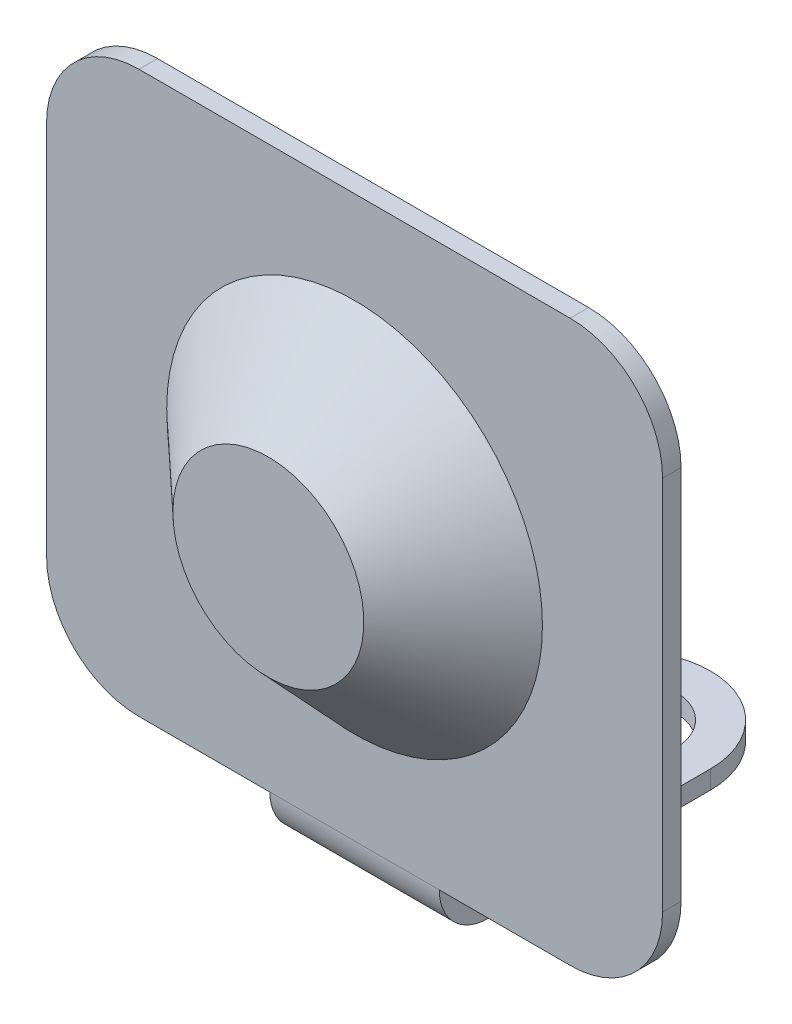
from build123d import *

# Parameters (mm, degrees)
SKETCH1_W                  = 10
SKETCH1_H                  = 9.1
BASE_FLANGE1_DEPTH         = 0.3
TAB1_DEPTH                 = 0.3
SKETCHED_START             = -12
SKETCHED_BEND1_OUTLINE_W   = 2.75
SKETCHED_BEND1_OUTLINE_H   = 0.3
SKETCHED_BEND1_DEPTH       = 6.725504
SKETCHED_START_2           = -5.274496
SKETCHED_BEND1_2_OUTLINE_W = 2.75
SKETCHED_BEND1_2_OUTLINE_H = 0.3
SKETCHED_BEND1_2_DEPTH     = 0.074434719
SKETCHED_START_3           = -5.35
SKETCHED_BEND1_3_DEPTH     = 0.8
SKETCHED_START_4           = -1.375
SKETCHED_BEND1_4_DEPTH     = 2.75
FILLET1_R                  = 1.5
SKETCH13_R                 = 0.8
CUT_EXTRUDE2_DEPTH         = 13.370499101


with BuildPart() as part:
    # Base-Flange1: sheet metal written as solids
    # Sketch1 → Base-Flange1 (new body)
    with BuildSketch(Plane.XY):
        Rectangle(SKETCH1_W, SKETCH1_H)
    extrude(amount=BASE_FLANGE1_DEPTH)

    # Tab1: sheet metal written as solids
    # Sketch7 → Tab1 (add)
    with BuildSketch(Plane.XY):
        with BuildLine():
            Line((1.375, 0), (1.375, -9.175))
            ThreePointArc((1.375, -9.175), (0, -10.55), (-1.375, -9.175))
            Line((-1.375, -9.175), (-1.375, 0))
            ThreePointArc((-1.375, 0), (0, 1.375), (1.375, 0))
        make_face()
    extrude(amount=TAB1_DEPTH)

    # Sketched Bend1: read off the stored shape, not the designer's step
    # Sketched Bend1 outline → Sketched Bend1 (cut)
    with BuildSketch(Plane(origin=(0, 0, 0), x_dir=(1, 0, 0), z_dir=(0, 1, 0)).offset(SKETCHED_START)):
        with Locations((0, -0.15)):
            Rectangle(SKETCHED_BEND1_OUTLINE_W, SKETCHED_BEND1_OUTLINE_H)
    extrude(amount=SKETCHED_BEND1_DEPTH, mode=Mode.SUBTRACT)

    # Sketched Bend1 2 outline → Sketched Bend1 2 (cut)
    with BuildSketch(Plane(origin=(0, 0, 0), x_dir=(1, 0, 0), z_dir=(0, 1, 0)).offset(SKETCHED_START_2)):
        with Locations((0, -0.15)):
            Rectangle(SKETCHED_BEND1_2_OUTLINE_W, SKETCHED_BEND1_2_OUTLINE_H)
    extrude(amount=SKETCHED_BEND1_2_DEPTH, mode=Mode.SUBTRACT)

    # Sketched Bend1 3 outline → Sketched Bend1 3 (add)
    with BuildSketch(Plane(origin=(0, 0, 0), x_dir=(1, 0, 0), z_dir=(0, 1, 0)).offset(SKETCHED_START_3)):
        with BuildLine():
            Line((-1.375, 4.103982388), (-1.375, 0))
            Line((-1.375, 0), (1.375, 0))
            Line((1.375, 0), (1.375, 4.103982388))
            ThreePointArc((1.375, 4.103982388), (0, 5.478982388), (-1.375, 4.103982388))
        make_face()
    extrude(amount=SKETCHED_BEND1_3_DEPTH)

    # Sketched Bend1 4 outline → Sketched Bend1 4 (cut)
    with BuildSketch(Plane.YZ.offset(SKETCHED_START_4)):
        with BuildLine():
            Line((-5.05, -0.5), (-5.05, -7))
            Line((-5.05, -7), (-4.55, -7))
            Line((-4.55, -7), (-4.55, 0))
            ThreePointArc((-4.55, 0), (-4.903553391, -0.146446609), (-5.05, -0.5))
        make_face()
        with BuildLine():
            Line((-7, -7), (-5.349999999, -7))
            Line((-5.349999999, -7), (-5.35, -0.5))
            ThreePointArc((-5.35, -0.5), (-5.115685425, 0.065685425), (-4.55, 0.3))
            Line((-4.55, 0.3), (-3, 0.3))
            Line((-3, 0.3), (-3, 2))
            Line((-3, 2), (-5.200061281, 2))
            Line((-5.200061281, 2), (-5.200061281, 0))
            Line((-5.200061281, 0), (-7, 0))
            Line((-7, 0), (-7, -7))
        make_face()
    extrude(amount=SKETCHED_BEND1_4_DEPTH, mode=Mode.SUBTRACT)

    # Fillet1
    fillet1_edges = [part.edges().sort_by_distance(p)[0] for p in [
        (-5, 4.55, 0.15),
        (5, 4.55, 0.15),
        (5, -4.55, 0.15),
        (-5, -4.55, 0.15),
    ]]
    fillet(fillet1_edges, radius=FILLET1_R)

    # Sketch13 → Cut-Extrude2 (cut, through all)
    with BuildSketch(Plane.XZ.offset(5.35)):
        with Locations(Location((0, -4.103982388, 0), (0, 0, 270))):
            Circle(SKETCH13_R)
    extrude(amount=-CUT_EXTRUDE2_DEPTH, mode=Mode.SUBTRACT)

    # Sketch14 → Revolve1 (revolve)
    with BuildSketch(Plane(origin=(0, 0, 0), x_dir=(1, 0, 0), z_dir=(0, 1, 0)), mode=Mode.PRIVATE) as revolve1_sk:
        Polygon((0, -0.3), (3.05, -0.3), (1.55, -1.7), (0, -1.7), align=None)
    revolve(revolve1_sk.sketch.rotate(Axis((0, 0, -88.99), (0, 0, 1)), 180), axis=Axis((0, 0, -88.99), (0, 0, 1)))


solid = part.part
